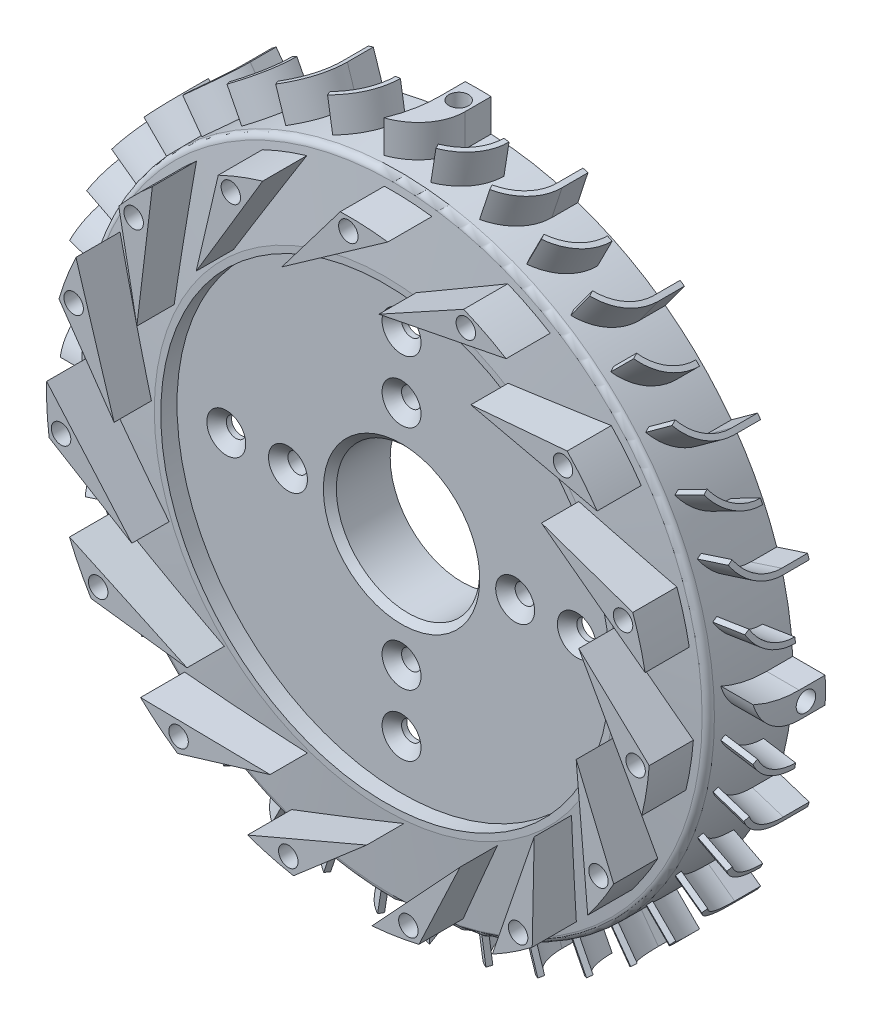
from build123d import *

# Parameters (mm, degrees)
ESQUISSE2_R                               = 1.5
ENL_V_MAT_EXTRU_1_DEPTH                   = 70.596982693
CHANFREIN1_SIZE                           = 1.5
R_P_TITION_CIRCULAIRE1_COUNT              = 4
CHANFREIN1_OF_R_P_TITION_CIRCULAIRE1_SIZE = 1.5
BOSS_EXTRU_1_START                        = -6.687597
BOSS_EXTRU_1_DEPTH                        = 6.687597
R_P_TITION_CIRCULAIRE3_COUNT              = 40
BOSS_EXTRU_2_REACH                        = 125.798
BOSS_EXTRU_2_END_RADIUS                   = 48.5
ESQUISSE5_R                               = 1.25
ENL_V_MAT_EXTRU_2_DEPTH                   = 10
R_P_TITION_CIRCULAIRE4_COUNT              = 4
BOSS_EXTRU_3_REACH                        = 82.312
ESQUISSE7_R                               = 1.5
ENL_V_MAT_EXTRU_3_DEPTH                   = 81.311892183
CIRPATTERN2_COUNT                         = 15
CIRPATTERN3_COUNT                         = 15
CHANFREIN2_SIZE                           = 1
ENL_V_MAT_EXTRU_5_DEPTH                   = 4
R_P_TITION_CIRCULAIRE6_COUNT              = 20
SKETCH5_R                                 = 13
SKETCH5_R_2                               = 11.05
BOSS_EXTRUDE6_DEPTH                       = 5
CUT_EXTRUDE1_START                        = -11
SKETCH6_R                                 = 1.5
CUT_EXTRUDE1_DEPTH                        = 135.812317787
CIRPATTERN4_COUNT                         = 4
SKETCH7_R                                 = 59.802166594
SKETCH7_R_2                               = 53.5
CUT_EXTRUDE2_DEPTH                        = 80.085333816


with BuildPart() as part:
    # Esquisse1 → Base-Révolution (revolve)
    with BuildSketch(Plane(origin=(0, 0, 0), x_dir=(0, 0, -1), z_dir=(1, 0, 0)), mode=Mode.PRIVATE) as base_r_volution_sk:
        with BuildLine():
            Line((2.204289799, 48.5), (14.3, 48.5))
            Line((14.3, 48.5), (14.3, 47.5))
            Line((14.3, 47.5), (13.8, 47.5))
            ThreePointArc((13.8, 47.5), (4.838275836, 42.340678547), (4.8, 32))
            Line((4.8, 32), (4.8, 21.5))
            ThreePointArc((4.8, 21.5), (5.239339828, 20.439339828), (6.3, 20))
            Line((6.3, 20), (6.8, 20))
            Line((6.8, 20), (6.8, 11.05))
            Line((6.8, 11.05), (2.5, 11.05))
            Line((2.5, 11.05), (2.5, 34.6))
            Line((2.5, 34.6), (0, 34.6))
            Line((0, 34.6), (0, 35.6))
            Line((0, 35.6), (1.209329267, 47.60026734))
            ThreePointArc((1.209329267, 47.60026734), (1.533569045, 48.241709964), (2.204289799, 48.5))
        make_face()
    revolve(base_r_volution_sk.sketch.rotate(Axis((0, 0, 62.438946015), (0, 0, -1)), 90), axis=Axis((0, 0, 62.438946015), (0, 0, -1)))

    # Esquisse2 → Enlèv. mat.-Extru.1 (cut, through all)
    with BuildSketch(Plane.XY.offset(-2.5)):
        with Locations((0, 27)):
            Circle(ESQUISSE2_R)
        with Locations((0, 17.5)):
            Circle(ESQUISSE2_R)
    enl_v_mat_extru_1 = extrude(amount=-ENL_V_MAT_EXTRU_1_DEPTH, mode=Mode.SUBTRACT)

    # Chanfrein1
    chanfrein1_edges = [part.edges().sort_by_distance(p)[0] for p in [
        (-1.5, 27, -2.5),
        (-1.5, 17.5, -2.5),
    ]]
    chamfer(chanfrein1_edges, length=CHANFREIN1_SIZE)

    # Répétition circulaire1: Enlèv. mat.-Extru.1 ×4 about axis
    r_p_tition_circulaire1_axis = Axis((0, 0, 0), (0, 0, 1))
    for i in range(1, R_P_TITION_CIRCULAIRE1_COUNT):
        add(enl_v_mat_extru_1.rotate(r_p_tition_circulaire1_axis, i * 360 / R_P_TITION_CIRCULAIRE1_COUNT), mode=Mode.SUBTRACT)

    # Chanfrein1 of Répétition circulaire1
    chanfrein1_of_r_p_tition_circulaire1_edges = [part.edges().sort_by_distance(p)[0] for p in [
        (-27, -1.5, -2.5),
        (-17.5, -1.5, -2.5),
        (1.5, -27, -2.5),
        (1.5, -17.5, -2.5),
        (27, 1.5, -2.5),
        (17.5, 1.5, -2.5),
    ]]
    chamfer(chanfrein1_of_r_p_tition_circulaire1_edges, length=CHANFREIN1_OF_R_P_TITION_CIRCULAIRE1_SIZE)

    # Esquisse3 → Boss.-Extru.1 (add)
    with BuildSketch(Plane(origin=(8.603895577, -54.322858733, 0), x_dir=(0.9876883405951378, 0.15643446504023126, 0), z_dir=(0.15643446504023126, -0.9876883405951378, 0)).offset(BOSS_EXTRU_1_START)):
        with BuildLine():
            Line((-0.4, -14.3), (-0.4, -10.3))
            ThreePointArc((-0.4, -10.3), (0.760859498, -6.19238512), (3.9, -3.3))
            Line((3.9, -3.3), (4.261653578, -4.013587198))
            ThreePointArc((4.261653578, -4.013587198), (1.442520287, -6.611119605), (0.4, -10.3))
            Line((0.4, -10.3), (0.4, -14.3))
            Line((0.4, -14.3), (-0.4, -14.3))
        make_face()
    boss_extru_1 = extrude(amount=BOSS_EXTRU_1_DEPTH)

    # Répétition circulaire3: Boss.-Extru.1 ×40 about axis, 4 skipped
    r_p_tition_circulaire3_axis = Axis((0, 0, 62.438946015), (0, 0, -1))
    add([boss_extru_1.rotate(r_p_tition_circulaire3_axis, i * 360 / R_P_TITION_CIRCULAIRE3_COUNT) for i in range(1, R_P_TITION_CIRCULAIRE3_COUNT) if i not in (1, 11, 21, 31)])

    # Boss.-Extru.2: up to this cylinder (the profile starts outside it)
    boss_extru_2_end = Plane(origin=(0, 0, -9.485263), z_dir=(0, 0, 1)) * Cylinder(BOSS_EXTRU_2_END_RADIUS, 349.596, mode=Mode.PRIVATE)
    # Esquisse4 → Boss.-Extru.2 (add, up to the surface)
    with BuildSketch(Plane(origin=(0, 55, 0), x_dir=(-1, 0, 0), z_dir=(0, 1, 0)), mode=Mode.PRIVATE) as boss_extru_2_sk1:
        with BuildLine():
            Line((-2, -14.3), (-2, -10.3))
            ThreePointArc((-2, -10.3), (-0.460520759, -5.848876546), (3.5, -3.3))
            ThreePointArc((3.5, -3.3), (2.37920876, -6.720544734), (2, -10.3))
            Line((2, -10.3), (2, -14.3))
            Line((2, -14.3), (-2, -14.3))
        make_face()
    boss_extru_2_tool1 = extrude(boss_extru_2_sk1.sketch, amount=-BOSS_EXTRU_2_REACH, mode=Mode.PRIVATE) - boss_extru_2_end
    boss_extru_2 = boss_extru_2_tool1.solids().sort_by_distance((-0.374446, 55, -9.485263))[0]
    add(boss_extru_2)

    # Esquisse5 → Enlèv. mat.-Extru.2 (cut)
    with BuildSketch(Plane(origin=(0, 55, 0), x_dir=(-1, 0, 0), z_dir=(0, 1, 0))):
        with Locations(Location((0, -11.3, 0), (0, 0, 90))):
            Circle(ESQUISSE5_R)
    enl_v_mat_extru_2 = extrude(amount=-ENL_V_MAT_EXTRU_2_DEPTH, mode=Mode.SUBTRACT)

    # Répétition circulaire4: Boss.-Extru.2, Enlèv. mat.-Extru.2 ×4 about axis
    r_p_tition_circulaire4_axis = Axis((0, 0, 0), (0, 0, 1))
    add([boss_extru_2.rotate(r_p_tition_circulaire4_axis, i * 360 / R_P_TITION_CIRCULAIRE4_COUNT) for i in range(1, R_P_TITION_CIRCULAIRE4_COUNT)])
    add([enl_v_mat_extru_2.rotate(r_p_tition_circulaire4_axis, i * 360 / R_P_TITION_CIRCULAIRE4_COUNT) for i in range(1, R_P_TITION_CIRCULAIRE4_COUNT)], mode=Mode.SUBTRACT)

    # Boss.-Extru.3: up to this cone (the profile starts outside it)
    boss_extru_3_end = Plane(origin=(0, 0, 5.7), z_dir=(0, 0, -1)).offset(2.112404101) * Cone(9.923e-06, 800.788307692, 80.699595899, align=(Align.CENTER, Align.CENTER, Align.MIN), mode=Mode.PRIVATE)
    # Esquisse6 → Boss.-Extru.3 (add, up to the surface)
    with BuildSketch(Plane(origin=(0, 0, 5.7), x_dir=(-1, 0, 0), z_dir=(0, 0, -1)), mode=Mode.PRIVATE) as boss_extru_3_sk1:
        with BuildLine():
            Line((10.245181122, 34.615693894), (1.243096781, 46.483381013))
            ThreePointArc((1.243096781, 46.483381013), (-2.42591451, 46.436676655), (-6.079820198, 46.100821971))
            Line((-6.079820198, 46.100821971), (10.245181122, 34.615693894))
        make_face()
    boss_extru_3_tool1 = extrude(boss_extru_3_sk1.sketch, amount=BOSS_EXTRU_3_REACH, mode=Mode.PRIVATE) - boss_extru_3_end
    boss_extru_3 = boss_extru_3_tool1.solids().sort_by_distance((-1.737641, 42.460912, 5.7))[0]
    add(boss_extru_3)

    # Esquisse7 → Enlèv. mat.-Extru.3 (cut, through all)
    with BuildSketch(Plane.XY.offset(5.7)):
        with Locations((0, 44.5)):
            Circle(ESQUISSE7_R)
    enl_v_mat_extru_3 = extrude(amount=-ENL_V_MAT_EXTRU_3_DEPTH, mode=Mode.SUBTRACT)

    # CirPattern2: Boss.-Extru.3 ×15 about axis
    cirpattern2_axis = Axis((0, 0, 0), (0, 0, 1))
    for i in range(1, CIRPATTERN2_COUNT):
        add(boss_extru_3.rotate(cirpattern2_axis, i * 360 / CIRPATTERN2_COUNT))

    # CirPattern3: Enlèv. mat.-Extru.3 ×15 about axis
    cirpattern3_axis = Axis((0, 0, 0), (0, 0, 1))
    for i in range(1, CIRPATTERN3_COUNT):
        add(enl_v_mat_extru_3.rotate(cirpattern3_axis, i * 360 / CIRPATTERN3_COUNT), mode=Mode.SUBTRACT)

    # Chanfrein2
    chanfrein2_edges = [part.edges().sort_by_distance(p)[0] for p in [
        (-11.05, 0, -2.5),
    ]]
    chamfer(chanfrein2_edges, length=CHANFREIN2_SIZE)

    # Esquisse10 → Enlèv. mat.-Extru.5 (cut)
    with BuildSketch(Plane(origin=(0, 0, -14.3), x_dir=(-1, 0, 0), z_dir=(0, 0, -1))):
        with BuildLine():
            Line((-8.926509186, 47.671453027), (-10.145134519, 54.179443902))
            Line((-10.145134519, 54.179443902), (-6.795643287, 54.806638216))
            Line((-6.795643287, 54.806638216), (-5.554956732, 48.180830791))
            ThreePointArc((-5.554956732, 48.180830791), (-7.245210847, 47.95578088), (-8.926509186, 47.671453027))
        make_face()
    enl_v_mat_extru_5 = extrude(amount=-ENL_V_MAT_EXTRU_5_DEPTH, mode=Mode.SUBTRACT)

    # Répétition circulaire6: Enlèv. mat.-Extru.5 ×20 about axis
    r_p_tition_circulaire6_axis = Axis((0, 0, 62.438946015), (0, 0, -1))
    for i in range(1, R_P_TITION_CIRCULAIRE6_COUNT):
        add(enl_v_mat_extru_5.rotate(r_p_tition_circulaire6_axis, i * 360 / R_P_TITION_CIRCULAIRE6_COUNT), mode=Mode.SUBTRACT)

    # Sketch5 → Boss-Extrude6 (add)
    with BuildSketch(Plane(origin=(0, 0, -6.8), x_dir=(-1, 0, 0), z_dir=(0, 0, -1))):
        with Locations(Location((0, 0, 0), (0, 0, 180))):
            Circle(SKETCH5_R)
        Circle(SKETCH5_R_2, mode=Mode.SUBTRACT)
    extrude(amount=BOSS_EXTRUDE6_DEPTH)

    # Sketch6 → Cut-Extrude1 (cut)
    with BuildSketch(Plane(origin=(0, 55, 0), x_dir=(1, 0, 0), z_dir=(0, 1, 0)).offset(CUT_EXTRUDE1_START)):
        with Locations(Location((0, 11.3, 0), (0, 0, 136.398375484))):
            Circle(SKETCH6_R)
    cut_extrude1 = extrude(amount=CUT_EXTRUDE1_DEPTH, mode=Mode.SUBTRACT)

    # CirPattern4: Cut-Extrude1 ×4 about axis
    cirpattern4_axis = Axis((0, 0, -3.5), (0, 0, -1))
    for i in range(1, CIRPATTERN4_COUNT):
        add(cut_extrude1.rotate(cirpattern4_axis, i * 360 / CIRPATTERN4_COUNT), mode=Mode.SUBTRACT)

    # Sketch7 → Cut-Extrude2 (cut, through all)
    with BuildSketch(Plane.XY):
        Circle(SKETCH7_R)
        Circle(SKETCH7_R_2, mode=Mode.SUBTRACT)
    extrude(amount=-CUT_EXTRUDE2_DEPTH, mode=Mode.SUBTRACT)


solid = part.part
